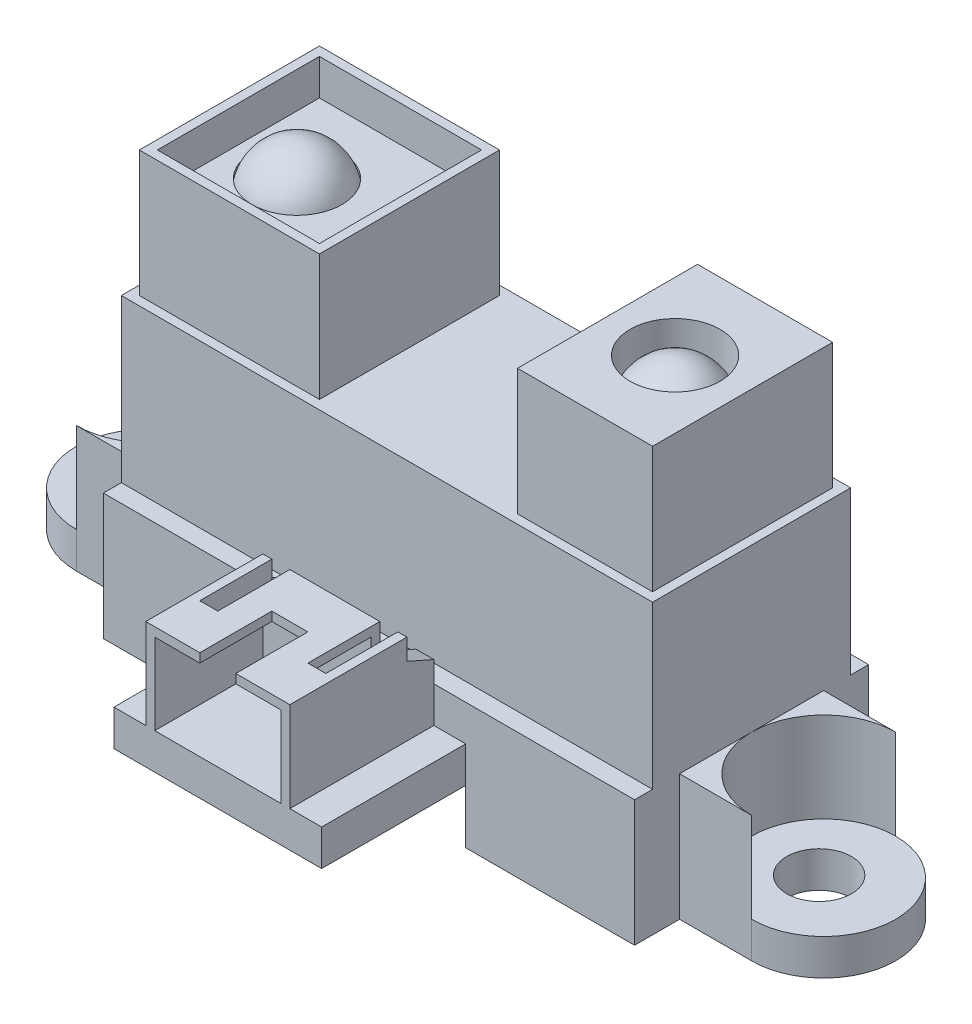
from build123d import *

# Parameters (mm, degrees)
EXTRUDE_1_DEPTH     = 7
CUT_EXTRUDE_START   = -5
SKETCH_2_R          = 4
CUT_EXTRUDE_1_DEPTH = 5
SKETCH_3_W          = 29.5
SKETCH_3_H          = 11
EXTRUDE_2_DEPTH     = 9
SKETCH_4_W          = 7.5
SKETCH_4_H          = 10
SKETCH_4_W_2        = 10
EXTRUDE_3_DEPTH     = 7
SKETCH_5_W          = 9
SKETCH_5_H          = 9
CUT_EXTRUDE_2_DEPTH = 2
SKETCH_6_R          = 2.5
CUT_EXTRUDE_3_DEPTH = 2.2
SKETCH_7_R          = 1.796075295
CUT_EXTRUDE_4_DEPTH = 45.902672526
SKETCH_8_W          = 11.533749137
SKETCH_8_H          = 5
EXTRUDE_4_DEPTH     = 8
CUT_EXTRUDE_5_DEPTH = 3
SKETCH_11_W         = 8
SKETCH_11_H         = 6.5
EXTRUDE_6_DEPTH     = 5
EXTRUDE_7_DEPTH     = 1
EXTRUDE_8_DEPTH     = 1
CUT_EXTRUDE_6_DEPTH = 4
SKETCH_15_W         = 7
SKETCH_15_H         = 4.5
CUT_EXTRUDE_7_DEPTH = 2
SKETCH_16_W         = 1
SKETCH_16_H         = 4
CUT_EXTRUDE_8_DEPTH = 1


# Read off the part's stored shape, not the designer's step: 圆顶1, 圆顶2
with BuildPart() as part:
    # 草图1 → 凸台-拉伸1 (new body)
    with BuildSketch(Plane(origin=(0, 0, 0), x_dir=(1, 0, 0), z_dir=(0, 1, 0))):
        with BuildLine():
            Line((0, 0), (29.5, 0))
            Line((29.5, 0), (29.5, -2.5))
            Line((29.5, -2.5), (33.5, -2.5))
            ThreePointArc((33.5, -2.5), (37.5, -6.5), (33.5, -10.5))
            Line((33.5, -10.5), (29.5, -10.5))
            Line((29.5, -10.5), (29.5, -13))
            Line((29.5, -13), (0, -13))
            Line((0, -13), (0, -10.5))
            Line((0, -10.5), (-4, -10.5))
            ThreePointArc((-4, -10.5), (-8, -6.5), (-4, -2.5))
            Line((-4, -2.5), (0, -2.5))
            Line((0, -2.5), (0, 0))
        make_face()
    extrude(amount=EXTRUDE_1_DEPTH)

    # 草图2 → 切除-拉伸1 (cut)
    with BuildSketch(Plane(origin=(0, 7, 0), x_dir=(1, 0, 0), z_dir=(0, 1, 0)).offset(CUT_EXTRUDE_START)):
        with Locations((-4, -6.5)):
            Circle(SKETCH_2_R)
        with Locations((33.5, -6.5)):
            Circle(SKETCH_2_R)
    extrude(amount=CUT_EXTRUDE_1_DEPTH, mode=Mode.SUBTRACT)

    # 草图3 → 凸台-拉伸2 (add)
    with BuildSketch(Plane(origin=(0, 7, 0), x_dir=(1, 0, 0), z_dir=(0, 1, 0))):
        with Locations((14.75, -6.5)):
            Rectangle(SKETCH_3_W, SKETCH_3_H)
    extrude(amount=EXTRUDE_2_DEPTH)

    # 草图4 → 凸台-拉伸3 (add)
    with BuildSketch(Plane(origin=(0, 16, 0), x_dir=(1, 0, 0), z_dir=(0, 1, 0))):
        with Locations((25.25, -6.5)):
            Rectangle(SKETCH_4_W, SKETCH_4_H)
        with Locations((5.5, -6.5)):
            Rectangle(SKETCH_4_W_2, SKETCH_4_H)
    extrude(amount=EXTRUDE_3_DEPTH)

    # 草图5 → 切除-拉伸2 (cut)
    with BuildSketch(Plane(origin=(0, 23, 0), x_dir=(1, 0, 0), z_dir=(0, 1, 0))):
        with Locations((5.5, -6.5)):
            Rectangle(SKETCH_5_W, SKETCH_5_H)
    extrude(amount=-CUT_EXTRUDE_2_DEPTH, mode=Mode.SUBTRACT)

    # 草图6 → 切除-拉伸3 (cut)
    with BuildSketch(Plane(origin=(0, 23, 0), x_dir=(1, 0, 0), z_dir=(0, 1, 0))):
        with Locations(Location((25.25, -6.5, 0), (0, 0, 270))):
            Circle(SKETCH_6_R)
        with Locations(Location((4.253331237, -6.5, 0), (0, 0, 270))):
            Circle(SKETCH_6_R)
    extrude(amount=-CUT_EXTRUDE_3_DEPTH, mode=Mode.SUBTRACT)

    # 圆顶1 outline → 圆顶1 (revolve)
    with BuildSketch(Plane(origin=(4.253331237, 0, 6.5), x_dir=(1, 0, 0), z_dir=(0, 0, 1))):
        with BuildLine():
            Line((0, 20.8), (2.500000001, 20.799999998))
            ThreePointArc((2.500000001, 20.799999998), (1.60078106, 22.238476323), (0, 22.8))
            Line((0, 22.8), (0, 20.8))
        make_face()
    revolve(axis=Axis((4.253331237, 0, 6.5), (0, 1, 0)))

    # 圆顶2 outline → 圆顶2 (revolve)
    with BuildSketch(Plane(origin=(25.25, 0, 6.5), x_dir=(1, 0, 0), z_dir=(0, 0, 1))):
        with BuildLine():
            Line((0, 20.8), (2.500000001, 20.799999997))
            ThreePointArc((2.500000001, 20.799999997), (1.60078106, 22.238476323), (0, 22.8))
            Line((0, 22.8), (0, 20.8))
        make_face()
    revolve(axis=Axis((25.25, 0, 6.5), (0, 1, 0)))

    # 草图7 → 切除-拉伸4 (cut, through all)
    with BuildSketch(Plane(origin=(0, 2, 0), x_dir=(1, 0, 0), z_dir=(0, 1, 0))):
        with Locations(Location((-3.75, -6.5, 0), (0, 0, 270))):
            Circle(SKETCH_7_R)
        with Locations(Location((33.25, -6.5, 0), (0, 0, 270))):
            Circle(SKETCH_7_R)
    extrude(amount=-CUT_EXTRUDE_4_DEPTH, mode=Mode.SUBTRACT)

    # 草图8 → 凸台-拉伸4 (add)
    with BuildSketch(Plane.XY.offset(13)):
        with Locations((14.355989937, 2.5)):
            Rectangle(SKETCH_8_W, SKETCH_8_H)
    extrude(amount=EXTRUDE_4_DEPTH)

    # 草图10 → 切除-拉伸5 (cut)
    with BuildSketch(Plane.XZ):
        Polygon((8.589115368, 21), (8.589115368, 12), (1, 12), (1, 1), (28.5, 1), (28.5, 12), (20.122864505, 12), (20.122864505, 21), align=None)
    extrude(amount=-CUT_EXTRUDE_5_DEPTH, mode=Mode.SUBTRACT)

    # 草图11 → 凸台-拉伸6 (add)
    with BuildSketch(Plane(origin=(0, 5, 0), x_dir=(1, 0, 0), z_dir=(0, 1, 0))):
        with Locations((14.355989936, -17.75)):
            Rectangle(SKETCH_11_W, SKETCH_11_H)
    extrude(amount=EXTRUDE_6_DEPTH)

    # 草图12 → 凸台-拉伸7 (add)
    with BuildSketch(Plane(origin=(18.355989936, 0, 0), x_dir=(0, 0, -1), z_dir=(1, 0, 0))):
        Polygon((-14.5, 8.832927064), (-13, 8.172497524), (-13, 5), (-14.5, 5), align=None)
    extrude(amount=-EXTRUDE_7_DEPTH)

    # 草图13 → 凸台-拉伸8 (add)
    with BuildSketch(Plane.ZY.offset(-10.355989936)):
        Polygon((14.5, 8.832927064), (13, 8.172497524), (13, 5), (14.5, 5), align=None)
    extrude(amount=-EXTRUDE_8_DEPTH)

    # 草图14 → 切除-拉伸6 (cut)
    with BuildSketch(Plane.XY.offset(21)):
        Polygon((10.855989936, 5), (17.855989936, 5), (17.855989936, 9.5), (15.355989936, 9.5), (15.355989936, 10), (13.355989936, 10), (13.355989936, 9.5), (10.855989936, 9.5), align=None)
    extrude(amount=-CUT_EXTRUDE_6_DEPTH, mode=Mode.SUBTRACT)

    # 草图15 → 切除-拉伸7 (cut)
    with BuildSketch(Plane.XY.offset(17)):
        with Locations((14.355989936, 7.25)):
            Rectangle(SKETCH_15_W, SKETCH_15_H)
    extrude(amount=-CUT_EXTRUDE_7_DEPTH, mode=Mode.SUBTRACT)

    # 草图16 → 切除-拉伸8 (cut)
    with BuildSketch(Plane(origin=(0, 10, 0), x_dir=(1, 0, 0), z_dir=(0, 1, 0))):
        with Locations((11.355989936, -16.5)):
            Rectangle(SKETCH_16_W, SKETCH_16_H)
        with Locations((17.355989936, -16.5)):
            Rectangle(SKETCH_16_W, SKETCH_16_H)
    extrude(amount=-CUT_EXTRUDE_8_DEPTH, mode=Mode.SUBTRACT)


solid = part.part
